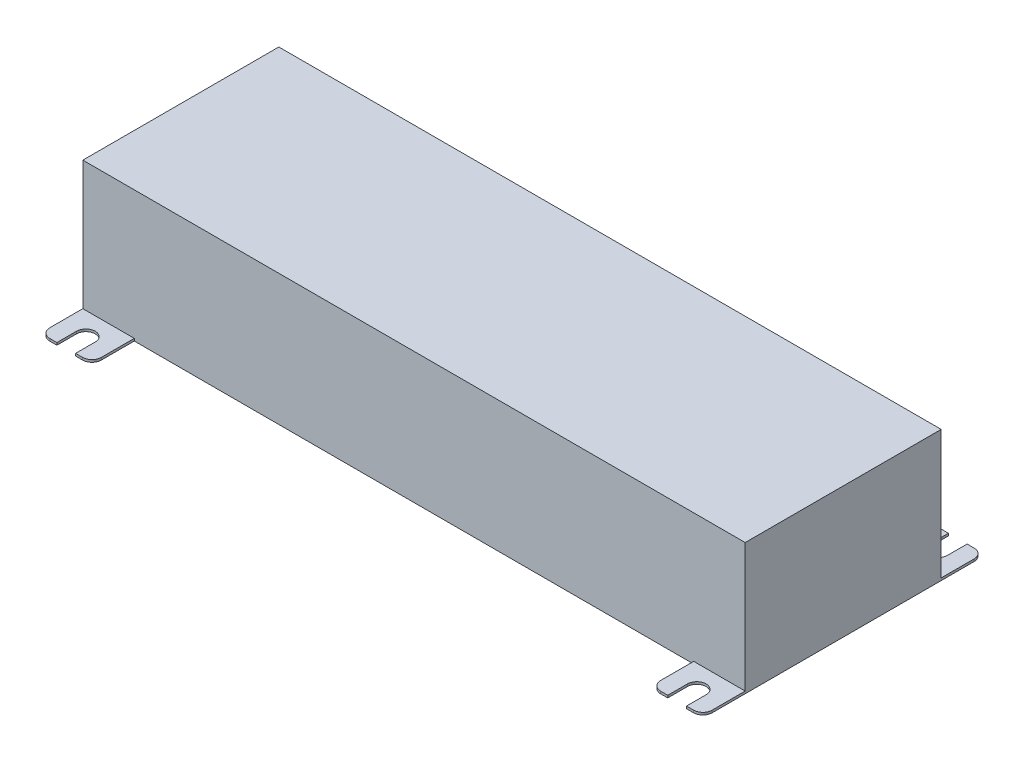
from build123d import *

# Parameters (mm, degrees)
SKETCH1_W            = 141.6
SKETCH1_H            = 41.9
BOSS_EXTRUDE1_DEPTH  = 28
SKETCH2_W            = 11
SKETCH2_H            = 0.5
BOSS_EXTRUDE2_DEPTH  = 9.05
FILLET1_R            = 2
SKETCH3_W            = 4
SKETCH3_H            = 4.2
CUT_EXTRUDE1_DEPTH   = 9.05
FILLET1_OF_MIRROR1_R = 2
MIRROR2_DEPTH        = 0.5


# Read off the part's stored shape, not the designer's step: Mirror2
with BuildPart() as part:
    # Sketch1 → Boss-Extrude1 (new body)
    with BuildSketch(Plane(origin=(0, 0, 0), x_dir=(1, 0, 0), z_dir=(0, 1, 0))):
        Rectangle(SKETCH1_W, SKETCH1_H)
    extrude(amount=BOSS_EXTRUDE1_DEPTH)

    # Sketch2 → Boss-Extrude2 (add)
    with BuildSketch(Plane.XY.offset(20.95)):
        with Locations((-65.3, 0.25)):
            Rectangle(SKETCH2_W, SKETCH2_H)
    boss_extrude2 = extrude(amount=BOSS_EXTRUDE2_DEPTH)

    # Fillet1
    fillet1_edges = [part.edges().sort_by_distance(p)[0] for p in [
        (-59.8, 0.25, 30),
        (-70.8, 0.25, 30),
    ]]
    fillet(fillet1_edges, radius=FILLET1_R)

    # Sketch3 → Cut-Extrude1 (cut)
    with BuildSketch(Plane(origin=(0, 0.5, 0), x_dir=(1, 0, 0), z_dir=(0, 1, 0))):
        with BuildLine():
            ThreePointArc((-67.3, -25.8), (-65.3, -23.8), (-63.3, -25.8))
            Line((-63.3, -25.8), (-67.3, -25.8))
        make_face()
        with Locations((-65.3, -27.9)):
            Rectangle(SKETCH3_W, SKETCH3_H)
    cut_extrude1 = extrude(amount=-CUT_EXTRUDE1_DEPTH, mode=Mode.SUBTRACT)

    # Mirror1: Boss-Extrude2, Cut-Extrude1 across plane
    add(boss_extrude2.mirror(Plane(origin=(0, 0, 0), x_dir=(0, 0, 1), z_dir=(1, 0, 0))))
    add(cut_extrude1.mirror(Plane(origin=(0, 0, 0), x_dir=(0, 0, 1), z_dir=(1, 0, 0))), mode=Mode.SUBTRACT)

    # Fillet1 of Mirror1
    fillet1_of_mirror1_edges = [part.edges().sort_by_distance(p)[0] for p in [
        (59.8, 0.25, 30),
        (70.8, 0.25, 30),
    ]]
    fillet(fillet1_of_mirror1_edges, radius=FILLET1_OF_MIRROR1_R)

    # Mirror2 outline → Mirror2 (add)
    with BuildSketch(Plane(origin=(0, 0, 0), x_dir=(1, 0, 0), z_dir=(0, 1, 0))):
        with BuildLine():
            Line((59.8, 28), (59.8, 20.95))
            Line((59.8, 20.95), (70.8, 20.95))
            Line((70.8, 20.95), (70.8, 28))
            ThreePointArc((70.8, 28), (70.214213562, 29.414213562), (68.8, 30))
            Line((68.8, 30), (67.3, 30))
            Line((67.3, 30), (67.3, 25.8))
            ThreePointArc((67.3, 25.8), (65.3, 23.8), (63.3, 25.8))
            Line((63.3, 25.8), (63.3, 30))
            Line((63.3, 30), (61.8, 30))
            ThreePointArc((61.8, 30), (60.385786438, 29.414213562), (59.8, 28))
        make_face()
        with BuildLine():
            Line((-67.3, 30), (-68.8, 30))
            ThreePointArc((-68.8, 30), (-70.214213562, 29.414213562), (-70.8, 28))
            Line((-70.8, 28), (-70.8, 20.95))
            Line((-70.8, 20.95), (-59.8, 20.95))
            Line((-59.8, 20.95), (-59.8, 28))
            ThreePointArc((-59.8, 28), (-60.385786438, 29.414213562), (-61.8, 30))
            Line((-61.8, 30), (-63.3, 30))
            Line((-63.3, 30), (-63.3, 25.8))
            ThreePointArc((-63.3, 25.8), (-65.3, 23.8), (-67.3, 25.8))
            Line((-67.3, 25.8), (-67.3, 30))
        make_face()
    extrude(amount=MIRROR2_DEPTH)


solid = part.part
